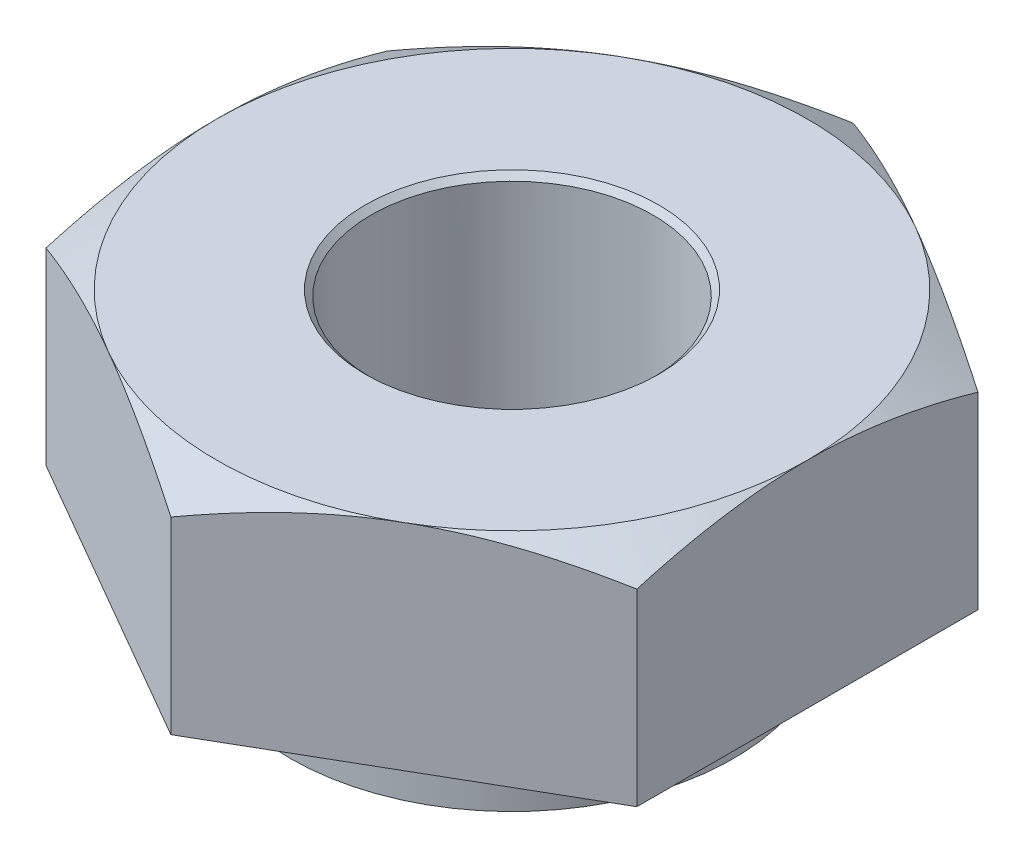
from build123d import *

# Parameters (mm, degrees)
BOSS_EXTRUDE1_DEPTH = 4.365625
SKETCH2_OUTSIDE_W   = 44.614
SKETCH2_OUTSIDE_H   = 45.964
SKETCH2_OUTSIDE_R   = 4.365625
CUT_EXTRUDE1_DEPTH  = 8.9705043
CUT_EXTRUDE1_DRAFT  = -60
SKETCH4_R           = 2.0828
CUT_EXTRUDE3_DEPTH  = 4.365625
SKETCH9_W           = 1.767564538
SKETCH9_H           = 1.190625


# Read off the part's stored shape, not the designer's step: Cut-Extrude4, Cut-Extrude5
with BuildPart() as part:
    # Sketch1 → Boss-Extrude1 (new body)
    with BuildSketch(Plane(origin=(0, 0, 0), x_dir=(1, 0, 0), z_dir=(0, 1, 0))):
        Polygon((0, 5.040989538), (-4.365625, 2.520494769), (-4.365625, -2.520494769), (0, -5.040989538), (4.365625, -2.520494769), (4.365625, 2.520494769), align=None)
    extrude(amount=BOSS_EXTRUDE1_DEPTH)


with BuildPart() as cut_extrude1_tool:
    # Sketch2 outside → Cut-Extrude1 (with draft: the straight prism first)
    with BuildSketch(Plane(origin=(0, 4.365625, 0), x_dir=(1, 0, 0), z_dir=(0, 1, 0))):
        Rectangle(SKETCH2_OUTSIDE_W, SKETCH2_OUTSIDE_H)
        Circle(SKETCH2_OUTSIDE_R, mode=Mode.SUBTRACT)
    extrude(amount=-CUT_EXTRUDE1_DEPTH)
    # Cut-Extrude1: the draft: its side faces are tilted about the plane it starts from
    cut_extrude1_sides = [cut_extrude1_tool.faces().sort_by_distance(p)[0] for p in [
        (0, -0.11962715, 22.982),
        (22.307, -0.11962715, 0),
        (0, -0.11962715, -22.982),
        (-22.307, -0.11962715, 0),
        (-4.365625, -0.11962715, 0),
    ]]
    draft(cut_extrude1_sides, Plane(origin=(0, 4.365625, 0), x_dir=(1, 0, 0), z_dir=(0, 1, 0)), CUT_EXTRUDE1_DRAFT)


with BuildPart() as part_1:
    add(part.part)

    # Cut-Extrude1: cut by cut_extrude1_tool
    add(cut_extrude1_tool.part, mode=Mode.SUBTRACT)

    # Sketch4 → Cut-Extrude3 (cut)
    with BuildSketch(Plane(origin=(0, 4.365625, 0), x_dir=(1, 0, 0), z_dir=(0, 1, 0))):
        with Locations(Location((0, 0, 0), (0, 0, 270))):
            Circle(SKETCH4_R)
    extrude(amount=-CUT_EXTRUDE3_DEPTH, mode=Mode.SUBTRACT)

    # Cut-Extrude4 outline → Cut-Extrude4 (revolve, cut)
    with BuildSketch(Plane.XY):
        Polygon((2.0828, 4.365625), (2.0828, 4.279699042), (2.168725958, 4.365625), align=None)
    revolve(axis=Axis((0, 0, 0), (0, 1, 0)), mode=Mode.SUBTRACT)

    # Cut-Extrude5 outline → Cut-Extrude5 (revolve, cut)
    with BuildSketch(Plane.XY):
        Polygon((2.168725958, 0), (2.0828, 0.085925958), (2.0828, 0), align=None)
    revolve(axis=Axis((0, 0, 0), (0, 1, 0)), mode=Mode.SUBTRACT)

    # Sketch9 → Cut-Revolve1 (revolve, cut)
    with BuildSketch(Plane(origin=(0, 0, 0), x_dir=(0, 0, -1), z_dir=(1, 0, 0)), mode=Mode.PRIVATE) as cut_revolve1_sk:
        with Locations((4.157207269, 0.5953125)):
            Rectangle(SKETCH9_W, SKETCH9_H)
    revolve(cut_revolve1_sk.sketch.rotate(Axis((0, 0, 0), (0, 1, 0)), 180), axis=Axis((0, 0, 0), (0, 1, 0)), mode=Mode.SUBTRACT)


solid = part_1.part
